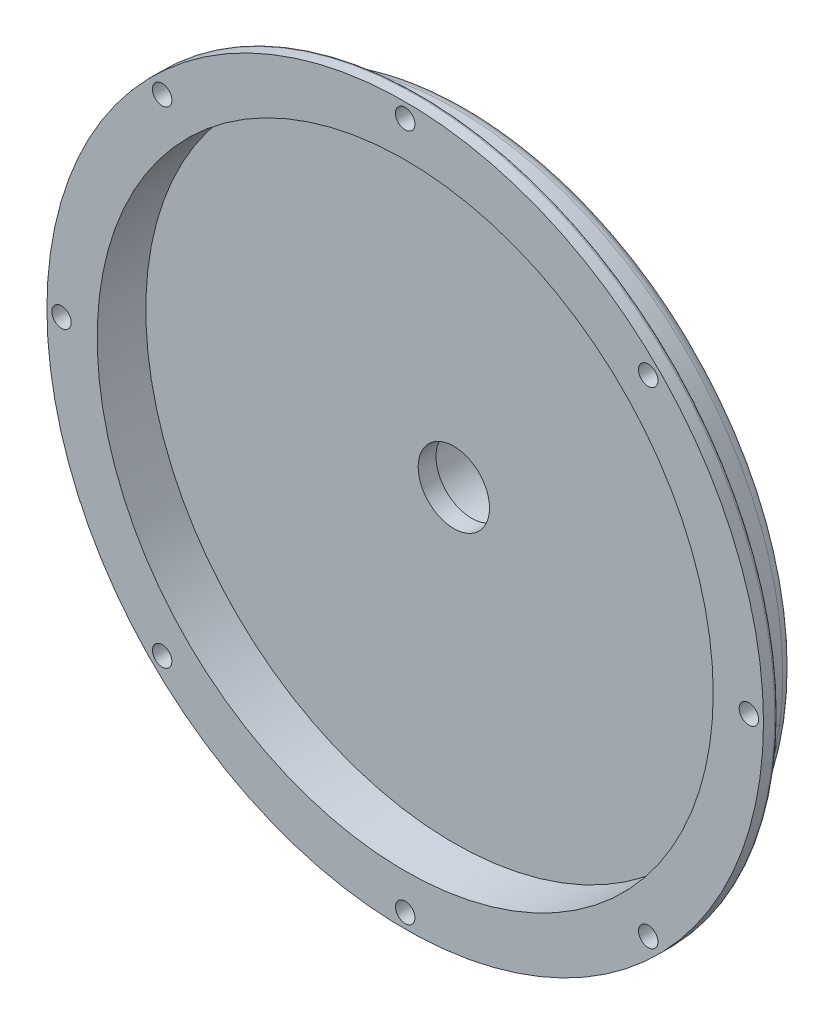
from build123d import *

# Parameters (mm, degrees)
SKETCH_2_R          = 3
CUT_EXTRUDE_1_DEPTH = 10
SKETCH_3_R          = 15
CUT_EXTRUDE_2_DEPTH = 5
EXTRUDE_START       = 14.5
SKETCH_7_R          = 17
SKETCH_7_R_2        = 15
EXTRUDE_1_DEPTH     = 14.5
SKETCH_5_R          = 95
CUT_EXTRUDE_4_DEPTH = 15
SKETCH_6_R          = 11
CUT_EXTRUDE_5_DEPTH = 15
FILLET_1_R          = 1
SKETCH_10_R         = 17.75
SKETCH_10_R_2       = 15.5
EXTRUDE_2_DEPTH     = 13


with BuildPart() as part:
    # Эскиз1 → Повернуть1 (revolve)
    with BuildSketch(Plane(origin=(0, 0, 0), x_dir=(1, 0, 0), z_dir=(0, 1, 0))):
        with BuildLine():
            Line((0, 25.5), (-26.5, 25.5))
            Line((-26.5, 25.5), (-26.5, 22.5))
            ThreePointArc((-26.5, 22.5), (-27.378679656, 20.378679656), (-29.5, 19.5))
            Line((-29.5, 19.5), (-96.637931261, 19.5))
            ThreePointArc((-96.637931261, 19.5), (-99.34998521, 18.440197846), (-100.624918852, 15.822381688))
            Line((-100.624918852, 15.822381688), (-101.46608759, 5.419404578))
            ThreePointArc((-101.46608759, 5.419404578), (-101.784821001, 4.764950538), (-102.462834488, 4.5))
            Line((-102.462834488, 4.5), (-109.5, 4.5))
            ThreePointArc((-109.5, 4.5), (-110.207106781, 4.207106781), (-110.5, 3.5))
            Line((-110.5, 3.5), (-110.5, 0))
            Line((-110.5, 0), (0, 0))
            Line((0, 0), (0, 25.5))
        make_face()
    revolve(axis=Axis((0, 0, 0), (0, 0, -1)))

    # Эскиз2 → Вырез-Вытянуть1 (cut)
    with BuildSketch(Plane.XY):
        with Locations((0, 106)):
            Circle(SKETCH_2_R)
        with Locations((74.953318806, 74.953318806)):
            Circle(SKETCH_2_R)
        with Locations((106, 0)):
            Circle(SKETCH_2_R)
        with Locations((74.953318806, -74.953318806)):
            Circle(SKETCH_2_R)
        with Locations((0, -106)):
            Circle(SKETCH_2_R)
        with Locations((-74.953318806, -74.953318806)):
            Circle(SKETCH_2_R)
        with Locations((-106, 0)):
            Circle(SKETCH_2_R)
        with Locations((-74.953318806, 74.953318806)):
            Circle(SKETCH_2_R)
    extrude(amount=-CUT_EXTRUDE_1_DEPTH, mode=Mode.SUBTRACT)

    # Эскиз3 → Вырез-Вытянуть2 (cut)
    with BuildSketch(Plane.XY.offset(-25.5)):
        Circle(SKETCH_3_R)
    extrude(amount=CUT_EXTRUDE_2_DEPTH, mode=Mode.SUBTRACT)

    # Эскиз7 → Бобышка-Вытянуть1 (add)
    with BuildSketch(Plane(origin=(0, 0, -25.5), x_dir=(-1, 0, 0), z_dir=(0, 0, -1)).offset(EXTRUDE_START)):
        Circle(SKETCH_7_R)
        Circle(SKETCH_7_R_2, mode=Mode.SUBTRACT)
    extrude(amount=-EXTRUDE_1_DEPTH)

    # Эскиз5 → Вырез-Вытянуть4 (cut)
    with BuildSketch(Plane.XY):
        Circle(SKETCH_5_R)
    extrude(amount=-CUT_EXTRUDE_4_DEPTH, mode=Mode.SUBTRACT)

    # Эскиз6 → Вырез-Вытянуть5 (cut)
    with BuildSketch(Plane(origin=(0, 0, -20.5), x_dir=(-1, 0, 0), z_dir=(0, 0, -1))):
        Circle(SKETCH_6_R)
    extrude(amount=-CUT_EXTRUDE_5_DEPTH, mode=Mode.SUBTRACT)

    # Скругление1
    fillet_1_edges = [part.edges().sort_by_distance(p)[0] for p in [
        (26.5, 0, -25.5),
    ]]
    fillet(fillet_1_edges, radius=FILLET_1_R)

    # Эскиз10 → Бобышка-Вытянуть2 (add)
    with BuildSketch(Plane(origin=(0, 0, -40), x_dir=(-1, 0, 0), z_dir=(0, 0, -1))):
        Circle(SKETCH_10_R)
        Circle(SKETCH_10_R_2, mode=Mode.SUBTRACT)
    extrude(amount=-EXTRUDE_2_DEPTH)

    # Эскиз15 → Вырез-Повернуть1 (revolve, cut)
    with BuildSketch(Plane(origin=(0, 0, 0), x_dir=(0, 0, -1), z_dir=(1, 0, 0))):
        Polygon((38.774646591, 18.035931276), (40.56291486, 15.49108797), (42.144844483, 15.49108797), (42.144844483, 19.342742704), (38.774646591, 19.342742704), align=None)
    revolve(axis=Axis((0, 0, -40.685830567), (0, 0, 1)), mode=Mode.SUBTRACT)


solid = part.part
